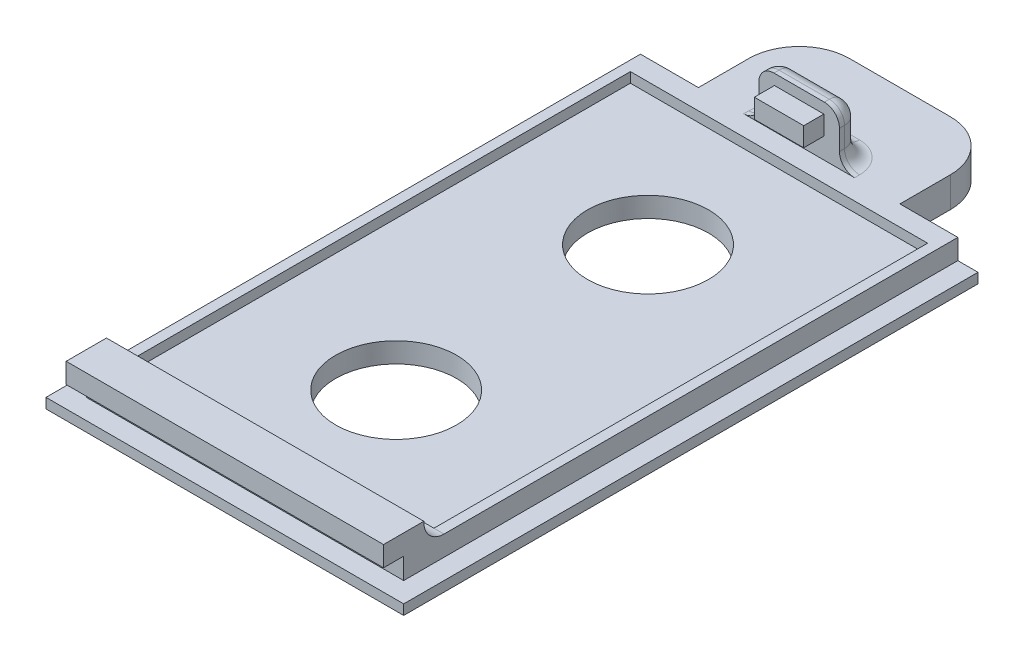
from build123d import *

# Parameters (mm, degrees)
BOSS_EXTRU_1_DEPTH      = 55
ESQUISSE2_W             = 35.5
ESQUISSE2_H             = 2
BOSS_EXTRU_2_DEPTH      = 1
BOSS_EXTRU_3_DEPTH      = 31.5
ESQUISSE4_W             = 8
ESQUISSE4_H             = 6.5
BOSS_EXTRU_4_DEPTH      = 2
ESQUISSE5_W             = 4.9
ESQUISSE5_H             = 1.9
BOSS_EXTRU_5_DEPTH      = 2
BOSS_EXTRU_6_DEPTH      = 3
ESQUISSE8_W             = 29.5
ESQUISSE8_H             = 49
ENL_V_MAT_EXTRU_2_DEPTH = 1
CONG_1_R                = 2
CONG_4_R                = 1.5
ESQUISSE7_R             = 6
ENL_V_MAT_EXTRU_1_DEPTH = 67.304223093


with BuildPart() as part:
    # Esquisse1 → Boss.-Extru.1 (new body)
    with BuildSketch(Plane.XY):
        Polygon((0, 0), (-2, 0), (-2, -1), (33.5, -1), (33.5, 0), (31.5, 0), (31.5, 2), (0, 2), align=None)
    extrude(amount=BOSS_EXTRU_1_DEPTH)

    # Esquisse2 → Boss.-Extru.2 (add)
    with BuildSketch(Plane.XZ.offset(1)):
        with Locations((15.75, 56)):
            Rectangle(ESQUISSE2_W, ESQUISSE2_H)
    extrude(amount=-BOSS_EXTRU_2_DEPTH)

    # Esquisse3 → Boss.-Extru.3 (add)
    with BuildSketch(Plane.ZY):
        Polygon((55, 2), (55, 2.1), (57, 2.1), (57, 4.1), (53, 4.1), (53, 2), align=None)
    extrude(amount=-BOSS_EXTRU_3_DEPTH)

    # Esquisse4 → Boss.-Extru.4 (add)
    with BuildSketch(Plane(origin=(0, 0, 0), x_dir=(-1, 0, 0), z_dir=(0, 0, -1))):
        with Locations((-15.75, 3.75)):
            Rectangle(ESQUISSE4_W, ESQUISSE4_H)
    extrude(amount=BOSS_EXTRU_4_DEPTH)

    # Esquisse5 → Boss.-Extru.5 (add)
    with BuildSketch(Plane.XY):
        with Locations((15.75, 5)):
            Rectangle(ESQUISSE5_W, ESQUISSE5_H)
    extrude(amount=BOSS_EXTRU_5_DEPTH)

    # Esquisse6 → Boss.-Extru.6 (add)
    with BuildSketch(Plane.XZ.offset(1)):
        with BuildLine():
            Line((5.75, 0), (5.75, -5))
            ThreePointArc((5.75, -5), (7.214466094, -8.535533906), (10.75, -10))
            Line((10.75, -10), (20.75, -10))
            ThreePointArc((20.75, -10), (24.285533906, -8.535533906), (25.75, -5))
            Line((25.75, -5), (25.75, 0))
            Line((25.75, 0), (5.75, 0))
        make_face()
    extrude(amount=-BOSS_EXTRU_6_DEPTH)

    # Esquisse8 → Enlèv. mat.-Extru.2 (cut)
    with BuildSketch(Plane(origin=(0, 2, 0), x_dir=(1, 0, 0), z_dir=(0, 1, 0))):
        with Locations((15.75, -26.5)):
            Rectangle(ESQUISSE8_W, ESQUISSE8_H)
    extrude(amount=-ENL_V_MAT_EXTRU_2_DEPTH, mode=Mode.SUBTRACT)

    # Congé1
    cong_1_edges = [part.edges().sort_by_distance(p)[0] for p in [
        (15.75, 2, 53),
    ]]
    fillet(cong_1_edges, radius=CONG_1_R - 0.0001)  # a hair under: the kernel refuses the full size

    # Congé4
    cong_4_edges = [part.edges().sort_by_distance(p)[0] for p in [
        (11.75, 7, -1),
        (19.75, 7, -1),
        (15.75, 7, -2),
        (19.75, 4.5, -2),
        (11.75, 4.5, -2),
        (15.75, 2, -2),
        (11.75, 2, -1),
        (19.75, 2, -1),
    ]]
    fillet(cong_4_edges, radius=CONG_4_R)

    # Esquisse7 → Enlèv. mat.-Extru.1 (cut, through all)
    with BuildSketch(Plane(origin=(0, 2, 0), x_dir=(1, 0, 0), z_dir=(0, 1, 0))):
        with Locations(Location((15.75, -15, 0), (0, 0, 180))):
            Circle(ESQUISSE7_R)
        with Locations(Location((15.75, -40, 0), (0, 0, 180))):
            Circle(ESQUISSE7_R)
    extrude(amount=-ENL_V_MAT_EXTRU_1_DEPTH, mode=Mode.SUBTRACT)


solid = part.part
